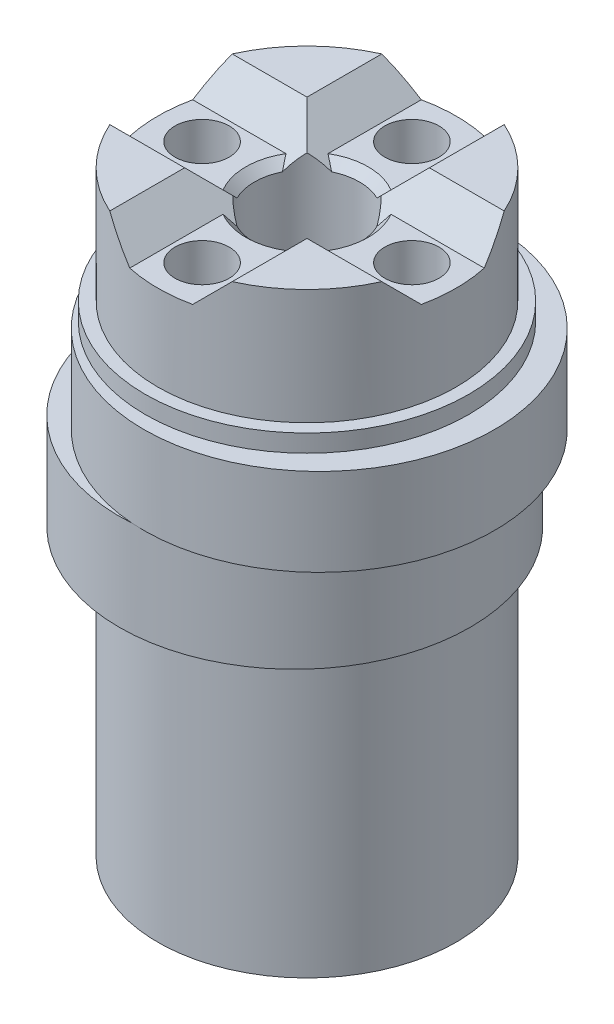
from build123d import *

# Parameters (mm, degrees)
SKETCH1_R            = 10.03
BOSS_EXTRUDE11_DEPTH = 5.5
SKETCH20_R           = 10.03
BOSS_EXTRUDE12_DEPTH = 5
SKETCH21_R           = 9.25
BOSS_EXTRUDE13_DEPTH = 1
SKETCH22_R           = 8.53
BOSS_EXTRUDE14_DEPTH = 6.6
BOSS_EXTRUDE15_START = 16
SKETCH30_R           = 8.53
BOSS_EXTRUDE15_DEPTH = 16
SKETCH31_R           = 1.55
CUT_EXTRUDE12_DEPTH  = 34.1
SKETCH33_R           = 2.1
CUT_EXTRUDE14_DEPTH  = 5.8
SKETCH36_R           = 3
CUT_EXTRUDE18_DEPTH  = 28.3
SKETCH37_W           = 9.5
SKETCH37_H           = 7
CUT_EXTRUDE19_DEPTH  = 1.7
CIRPATTERN1_COUNT    = 4
CHAMFER1_SIZE        = 1.7
CHAMFER2_SIZE        = 0.5


with BuildPart() as part:
    # Sketch1 → Boss-Extrude11 (new body)
    with BuildSketch(Plane(origin=(0, 0, 0), x_dir=(1, 0, 0), z_dir=(0, 1, 0))):
        with Locations(Location((0, 0, 0), (0, 0, 270))):
            Circle(SKETCH1_R)
    extrude(amount=BOSS_EXTRUDE11_DEPTH)

    # Sketch20 → Boss-Extrude12 (add)
    with BuildSketch(Plane(origin=(0, 5.5, 0), x_dir=(1, 0, 0), z_dir=(0, 1, 0))):
        with Locations(Location((1.4, 0, 0), (0, 0, 94.001961682))):
            Circle(SKETCH20_R)
    extrude(amount=BOSS_EXTRUDE12_DEPTH)

    # Sketch21 → Boss-Extrude13 (add)
    with BuildSketch(Plane(origin=(0, 10.5, 0), x_dir=(1, 0, 0), z_dir=(0, 1, 0))):
        with Locations(Location((0.7, 0, 0), (0, 0, 270))):
            Circle(SKETCH21_R)
    extrude(amount=BOSS_EXTRUDE13_DEPTH)

    # Sketch22 → Boss-Extrude14 (add)
    with BuildSketch(Plane(origin=(0, 11.5, 0), x_dir=(1, 0, 0), z_dir=(0, 1, 0))):
        with Locations(Location((0.7, 0, 0), (0, 0, 270))):
            Circle(SKETCH22_R)
    extrude(amount=BOSS_EXTRUDE14_DEPTH)

    # Sketch30 → Boss-Extrude15 (add)
    with BuildSketch(Plane.XZ.offset(BOSS_EXTRUDE15_START)):
        with Locations(Location((0.7, 0, 0), (0, 0, 90))):
            Circle(SKETCH30_R)
    extrude(amount=-BOSS_EXTRUDE15_DEPTH)

    # Sketch31 → Cut-Extrude12 (cut)
    with BuildSketch(Plane(origin=(0, 18.1, 0), x_dir=(1, 0, 0), z_dir=(0, 1, 0))):
        with Locations(Location((6.7, 0, 0), (0, 0, 270))):
            Circle(SKETCH31_R)
    cut_extrude12 = extrude(amount=-CUT_EXTRUDE12_DEPTH, mode=Mode.SUBTRACT)

    # Sketch33 → Cut-Extrude14 (cut)
    with BuildSketch(Plane.XZ.offset(16)):
        with Locations(Location((0.7, 0, 0), (0, 0, 270))):
            Circle(SKETCH33_R)
    extrude(amount=-CUT_EXTRUDE14_DEPTH, mode=Mode.SUBTRACT)

    # Sketch36 → Cut-Extrude18 (cut)
    with BuildSketch(Plane(origin=(0, 18.1, 0), x_dir=(1, 0, 0), z_dir=(0, 1, 0))):
        with Locations(Location((0.7, 0, 0), (0, 0, 270))):
            Circle(SKETCH36_R)
    extrude(amount=-CUT_EXTRUDE18_DEPTH, mode=Mode.SUBTRACT)

    # Sketch37 → Cut-Extrude19 (cut)
    with BuildSketch(Plane(origin=(0, 18.1, 0), x_dir=(1, 0, 0), z_dir=(0, 1, 0))):
        with Locations((5.45, 0)):
            Rectangle(SKETCH37_W, SKETCH37_H)
    cut_extrude19 = extrude(amount=-CUT_EXTRUDE19_DEPTH, mode=Mode.SUBTRACT)

    # CirPattern1: Cut-Extrude12, Cut-Extrude19 ×4 about axis
    cirpattern1_axis = Axis((0.7, 0, 0), (0, 1, 0))
    add([cut_extrude12.rotate(cirpattern1_axis, i * 360 / CIRPATTERN1_COUNT) for i in range(1, CIRPATTERN1_COUNT)], mode=Mode.SUBTRACT)
    add([cut_extrude19.rotate(cirpattern1_axis, i * 360 / CIRPATTERN1_COUNT) for i in range(1, CIRPATTERN1_COUNT)], mode=Mode.SUBTRACT)

    # Chamfer1
    # the kernel refuses this chamfer: 1.7 mm, written as the material it adds along each edge
    with BuildSketch(Plane(origin=(12.85073632, 16.4, -3.5), x_dir=(0, 0.9996219169112968, -0.027495876610586365), z_dir=(-1, 0, 0))) as chamfer1_piece_1_section:
        Polygon((CHAMFER1_SIZE * 0.999621916911, -CHAMFER1_SIZE * 0.0274958766106), (-CHAMFER1_SIZE * 0.0274958766106, -CHAMFER1_SIZE * 0.999621916911), (0, 0), align=None)
    chamfer1_piece_1 = extrude(amount=8.65073632, mode=Mode.PRIVATE)
    chamfer1_piece_1 = chamfer1_piece_1 & Plane(origin=(0.7, 16.951076754, 0), x_dir=(0, 0, 1), z_dir=(0, -1, 0)) * Cylinder(8.53, 25, mode=Mode.PRIVATE)
    chamfer1_piece_1 = split(chamfer1_piece_1, bisect_by=Plane(origin=(6.450066767, 18.1, -2.924017163), z_dir=(0, -1, 0)), keep=Keep.TOP, mode=Mode.PRIVATE)
    add(chamfer1_piece_1)
    with BuildSketch(Plane(origin=(4.2, 16.4, 3.5), x_dir=(0, 0.9996219169112968, 0.027495876610581792), z_dir=(1, 0, 0))) as chamfer1_piece_2_section:
        Polygon((CHAMFER1_SIZE * 0.999621916911, -CHAMFER1_SIZE * 0.0274958766106), (-CHAMFER1_SIZE * 0.0274958766106, -CHAMFER1_SIZE * 0.999621916911), (0, 0), align=None)
    chamfer1_piece_2 = extrude(amount=8.65073632, mode=Mode.PRIVATE)
    chamfer1_piece_2 = chamfer1_piece_2 & Plane(origin=(0.7, 16.951076754, 0), x_dir=(0, 0, 1), z_dir=(0, -1, 0)) * Cylinder(8.53, 25, mode=Mode.PRIVATE)
    chamfer1_piece_2 = split(chamfer1_piece_2, bisect_by=Plane(origin=(6.450066768, 18.1, 2.924017163), z_dir=(0, -1, 0)), keep=Keep.TOP, mode=Mode.PRIVATE)
    add(chamfer1_piece_2)
    with BuildSketch(Plane(origin=(-2.8, 16.4, -12.15073632), x_dir=(-0.027495876610586365, 0.9996219169112968, 0), z_dir=(0, 0, 1))) as chamfer1_piece_3_section:
        Polygon((CHAMFER1_SIZE * 0.999621916911, -CHAMFER1_SIZE * 0.0274958766106), (-CHAMFER1_SIZE * 0.0274958766106, -CHAMFER1_SIZE * 0.999621916911), (0, 0), align=None)
    chamfer1_piece_3 = extrude(amount=8.65073632, mode=Mode.PRIVATE)
    chamfer1_piece_3 = chamfer1_piece_3 & Plane(origin=(0.7, 16.951076754, 0), x_dir=(0, 0, 1), z_dir=(0, -1, 0)) * Cylinder(8.53, 25, mode=Mode.PRIVATE)
    chamfer1_piece_3 = split(chamfer1_piece_3, bisect_by=Plane(origin=(-2.224017163, 18.1, -5.750066767), z_dir=(0, -1, 0)), keep=Keep.TOP, mode=Mode.PRIVATE)
    add(chamfer1_piece_3)
    with BuildSketch(Plane(origin=(-2.8, 16.4, -3.5), x_dir=(0, 0.9996219169112968, -0.027495876610586365), z_dir=(-1, 0, 0))) as chamfer1_piece_4_section:
        Polygon((CHAMFER1_SIZE * 0.999621916911, -CHAMFER1_SIZE * 0.0274958766106), (-CHAMFER1_SIZE * 0.0274958766106, -CHAMFER1_SIZE * 0.999621916911), (0, 0), align=None)
    chamfer1_piece_4 = extrude(amount=8.65073632, mode=Mode.PRIVATE)
    chamfer1_piece_4 = chamfer1_piece_4 & Plane(origin=(0.7, 16.951076754, 0), x_dir=(0, 0, 1), z_dir=(0, -1, 0)) * Cylinder(8.53, 25, mode=Mode.PRIVATE)
    chamfer1_piece_4 = split(chamfer1_piece_4, bisect_by=Plane(origin=(-5.050066768, 18.1, -2.924017163), z_dir=(0, -1, 0)), keep=Keep.TOP, mode=Mode.PRIVATE)
    add(chamfer1_piece_4)
    with BuildSketch(Plane(origin=(-11.45073632, 16.4, 3.5), x_dir=(0, 0.9996219169112968, 0.027495876610586365), z_dir=(1, 0, 0))) as chamfer1_piece_5_section:
        Polygon((CHAMFER1_SIZE * 0.999621916911, -CHAMFER1_SIZE * 0.0274958766106), (-CHAMFER1_SIZE * 0.0274958766106, -CHAMFER1_SIZE * 0.999621916911), (0, 0), align=None)
    chamfer1_piece_5 = extrude(amount=8.65073632, mode=Mode.PRIVATE)
    chamfer1_piece_5 = chamfer1_piece_5 & Plane(origin=(0.7, 16.951076754, 0), x_dir=(0, 0, 1), z_dir=(0, -1, 0)) * Cylinder(8.53, 25, mode=Mode.PRIVATE)
    chamfer1_piece_5 = split(chamfer1_piece_5, bisect_by=Plane(origin=(-5.050066767, 18.1, 2.924017163), z_dir=(0, -1, 0)), keep=Keep.TOP, mode=Mode.PRIVATE)
    add(chamfer1_piece_5)
    with BuildSketch(Plane(origin=(-2.8, 16.4, 3.5), x_dir=(-0.027495876610586365, 0.9996219169112968, 0), z_dir=(0, 0, 1))) as chamfer1_piece_6_section:
        Polygon((CHAMFER1_SIZE * 0.999621916911, -CHAMFER1_SIZE * 0.0274958766106), (-CHAMFER1_SIZE * 0.0274958766106, -CHAMFER1_SIZE * 0.999621916911), (0, 0), align=None)
    chamfer1_piece_6 = extrude(amount=8.65073632, mode=Mode.PRIVATE)
    chamfer1_piece_6 = chamfer1_piece_6 & Plane(origin=(0.7, 16.951076754, 0), x_dir=(0, 0, 1), z_dir=(0, -1, 0)) * Cylinder(8.53, 25, mode=Mode.PRIVATE)
    chamfer1_piece_6 = split(chamfer1_piece_6, bisect_by=Plane(origin=(-2.224017163, 18.1, 5.750066768), z_dir=(0, -1, 0)), keep=Keep.TOP, mode=Mode.PRIVATE)
    add(chamfer1_piece_6)
    with BuildSketch(Plane(origin=(4.2, 16.4, 12.15073632), x_dir=(0.027495876610586365, 0.9996219169112968, 0), z_dir=(0, 0, -1))) as chamfer1_piece_7_section:
        Polygon((CHAMFER1_SIZE * 0.999621916911, -CHAMFER1_SIZE * 0.0274958766106), (-CHAMFER1_SIZE * 0.0274958766106, -CHAMFER1_SIZE * 0.999621916911), (0, 0), align=None)
    chamfer1_piece_7 = extrude(amount=8.65073632, mode=Mode.PRIVATE)
    chamfer1_piece_7 = chamfer1_piece_7 & Plane(origin=(0.7, 16.951076754, 0), x_dir=(0, 0, 1), z_dir=(0, -1, 0)) * Cylinder(8.53, 25, mode=Mode.PRIVATE)
    chamfer1_piece_7 = split(chamfer1_piece_7, bisect_by=Plane(origin=(3.624017163, 18.1, 5.750066767), z_dir=(0, -1, 0)), keep=Keep.TOP, mode=Mode.PRIVATE)
    add(chamfer1_piece_7)
    with BuildSketch(Plane(origin=(4.2, 16.4, -3.5), x_dir=(0.027495876610586365, 0.9996219169112968, 0), z_dir=(0, 0, -1))) as chamfer1_piece_8_section:
        Polygon((CHAMFER1_SIZE * 0.999621916911, -CHAMFER1_SIZE * 0.0274958766106), (-CHAMFER1_SIZE * 0.0274958766106, -CHAMFER1_SIZE * 0.999621916911), (0, 0), align=None)
    chamfer1_piece_8 = extrude(amount=8.65073632, mode=Mode.PRIVATE)
    chamfer1_piece_8 = chamfer1_piece_8 & Plane(origin=(0.7, 16.951076754, 0), x_dir=(0, 0, 1), z_dir=(0, -1, 0)) * Cylinder(8.53, 25, mode=Mode.PRIVATE)
    chamfer1_piece_8 = split(chamfer1_piece_8, bisect_by=Plane(origin=(3.624017163, 18.1, -5.750066768), z_dir=(0, -1, 0)), keep=Keep.TOP, mode=Mode.PRIVATE)
    add(chamfer1_piece_8)
    with BuildSketch(Plane(origin=(12.85073632, 16.4, -3.5), x_dir=(0, 0.9996219169112968, -0.027495876610586365), z_dir=(-1, 0, 0))) as chamfer1_piece_9a_section:
        Polygon((CHAMFER1_SIZE * 0.999621916911, -CHAMFER1_SIZE * 0.0274958766106), (-CHAMFER1_SIZE * 0.0274958766106, -CHAMFER1_SIZE * 0.999621916911), (0, 0), align=None)
    chamfer1_piece_9a = extrude(amount=13.022597399, mode=Mode.PRIVATE)
    chamfer1_piece_9a = split(chamfer1_piece_9a, bisect_by=Plane(origin=(2.33024723, 18.1, -3.085534958), z_dir=(0, -1, 0)), keep=Keep.TOP, mode=Mode.PRIVATE)
    chamfer1_piece_9a = split(chamfer1_piece_9a, bisect_by=Plane(origin=(4.2, 17.035605809, -3.085534958), z_dir=(-1, 0, 0)), keep=Keep.TOP, mode=Mode.PRIVATE)
    chamfer1_piece_9a = chamfer1_piece_9a - Plane(origin=(0.7, 17.035605809, 0), x_dir=(0, 0, 1), z_dir=(0, 1, 0)) * Cylinder(3, 33, mode=Mode.PRIVATE)
    with BuildSketch(Plane(origin=(4.2, 16.4, 0.87186108), x_dir=(0.027495876610586365, 0.9996219169112968, 0), z_dir=(0, 0, -1))) as chamfer1_piece_9b_section:
        Polygon((CHAMFER1_SIZE * 0.999621916911, -CHAMFER1_SIZE * 0.0274958766106), (-CHAMFER1_SIZE * 0.0274958766106, -CHAMFER1_SIZE * 0.999621916911), (0, 0), align=None)
    chamfer1_piece_9b = extrude(amount=13.022597399, mode=Mode.PRIVATE)
    chamfer1_piece_9b = split(chamfer1_piece_9b, bisect_by=Plane(origin=(3.785535078, 17.035605902, -3.5), z_dir=(0, 0, 1)), keep=Keep.TOP, mode=Mode.PRIVATE)
    chamfer1_piece_9b = split(chamfer1_piece_9b, bisect_by=Plane(origin=(3.785535078, 18.1, -1.630247283), z_dir=(0, -1, 0)), keep=Keep.TOP, mode=Mode.PRIVATE)
    chamfer1_piece_9b = chamfer1_piece_9b - Plane(origin=(0.7, 17.035605902, 0), x_dir=(0, 0, 1), z_dir=(0, 1, 0)) * Cylinder(3, 33, mode=Mode.PRIVATE)
    chamfer1_piece_9 = chamfer1_piece_9a & chamfer1_piece_9b
    add(chamfer1_piece_9)
    with BuildSketch(Plane(origin=(4.2, 16.4, 12.15073632), x_dir=(0.027495876610586365, 0.9996219169112968, 0), z_dir=(0, 0, -1))) as chamfer1_piece_10a_section:
        Polygon((CHAMFER1_SIZE * 0.999621916911, -CHAMFER1_SIZE * 0.0274958766106), (-CHAMFER1_SIZE * 0.0274958766106, -CHAMFER1_SIZE * 0.999621916911), (0, 0), align=None)
    chamfer1_piece_10a = extrude(amount=13.022597399, mode=Mode.PRIVATE)
    chamfer1_piece_10a = split(chamfer1_piece_10a, bisect_by=Plane(origin=(3.785534958, 18.1, 1.63024723), z_dir=(0, -1, 0)), keep=Keep.TOP, mode=Mode.PRIVATE)
    chamfer1_piece_10a = split(chamfer1_piece_10a, bisect_by=Plane(origin=(3.785534958, 17.035605809, 3.5), z_dir=(0, 0, -1)), keep=Keep.TOP, mode=Mode.PRIVATE)
    chamfer1_piece_10a = chamfer1_piece_10a - Plane(origin=(0.7, 17.035605809, 0), x_dir=(0, 0, 1), z_dir=(0, 1, 0)) * Cylinder(3, 33, mode=Mode.PRIVATE)
    with BuildSketch(Plane(origin=(-0.17186108, 16.4, 3.5), x_dir=(0, 0.9996219169112968, 0.027495876610586365), z_dir=(1, 0, 0))) as chamfer1_piece_10b_section:
        Polygon((CHAMFER1_SIZE * 0.999621916911, -CHAMFER1_SIZE * 0.0274958766106), (-CHAMFER1_SIZE * 0.0274958766106, -CHAMFER1_SIZE * 0.999621916911), (0, 0), align=None)
    chamfer1_piece_10b = extrude(amount=13.022597399, mode=Mode.PRIVATE)
    chamfer1_piece_10b = split(chamfer1_piece_10b, bisect_by=Plane(origin=(4.2, 17.035605903, 3.08553508), z_dir=(-1, 0, 0)), keep=Keep.TOP, mode=Mode.PRIVATE)
    chamfer1_piece_10b = split(chamfer1_piece_10b, bisect_by=Plane(origin=(2.330247274, 18.1, 3.08553508), z_dir=(0, -1, 0)), keep=Keep.TOP, mode=Mode.PRIVATE)
    chamfer1_piece_10b = chamfer1_piece_10b - Plane(origin=(0.7, 17.035605903, 0), x_dir=(0, 0, 1), z_dir=(0, 1, 0)) * Cylinder(3, 33, mode=Mode.PRIVATE)
    chamfer1_piece_10 = chamfer1_piece_10a & chamfer1_piece_10b
    add(chamfer1_piece_10)
    with BuildSketch(Plane(origin=(-2.8, 16.4, -12.15073632), x_dir=(-0.027495876610586365, 0.9996219169112968, 0), z_dir=(0, 0, 1))) as chamfer1_piece_11a_section:
        Polygon((CHAMFER1_SIZE * 0.999621916911, -CHAMFER1_SIZE * 0.0274958766106), (-CHAMFER1_SIZE * 0.0274958766106, -CHAMFER1_SIZE * 0.999621916911), (0, 0), align=None)
    chamfer1_piece_11a = extrude(amount=13.022597399, mode=Mode.PRIVATE)
    chamfer1_piece_11a = split(chamfer1_piece_11a, bisect_by=Plane(origin=(-2.385534958, 18.1, -1.63024723), z_dir=(0, -1, 0)), keep=Keep.TOP, mode=Mode.PRIVATE)
    chamfer1_piece_11a = split(chamfer1_piece_11a, bisect_by=Plane(origin=(-2.385534958, 17.035605809, -3.5), z_dir=(0, 0, 1)), keep=Keep.TOP, mode=Mode.PRIVATE)
    chamfer1_piece_11a = chamfer1_piece_11a - Plane(origin=(0.7, 17.035605809, 0), x_dir=(0, 0, 1), z_dir=(0, 1, 0)) * Cylinder(3, 33, mode=Mode.PRIVATE)
    with BuildSketch(Plane(origin=(1.57186108, 16.4, -3.5), x_dir=(0, 0.9996219169112968, -0.027495876610586365), z_dir=(-1, 0, 0))) as chamfer1_piece_11b_section:
        Polygon((CHAMFER1_SIZE * 0.999621916911, -CHAMFER1_SIZE * 0.0274958766106), (-CHAMFER1_SIZE * 0.0274958766106, -CHAMFER1_SIZE * 0.999621916911), (0, 0), align=None)
    chamfer1_piece_11b = extrude(amount=13.022597399, mode=Mode.PRIVATE)
    chamfer1_piece_11b = split(chamfer1_piece_11b, bisect_by=Plane(origin=(-2.8, 17.035605902, -3.085535078), z_dir=(1, 0, 0)), keep=Keep.TOP, mode=Mode.PRIVATE)
    chamfer1_piece_11b = split(chamfer1_piece_11b, bisect_by=Plane(origin=(-0.930247283, 18.1, -3.085535078), z_dir=(0, -1, 0)), keep=Keep.TOP, mode=Mode.PRIVATE)
    chamfer1_piece_11b = chamfer1_piece_11b - Plane(origin=(0.7, 17.035605902, 0), x_dir=(0, 0, 1), z_dir=(0, 1, 0)) * Cylinder(3, 33, mode=Mode.PRIVATE)
    chamfer1_piece_11 = chamfer1_piece_11a & chamfer1_piece_11b
    add(chamfer1_piece_11)
    with BuildSketch(Plane(origin=(-11.45073632, 16.4, 3.5), x_dir=(0, 0.9996219169112968, 0.027495876610586365), z_dir=(1, 0, 0))) as chamfer1_piece_12a_section:
        Polygon((CHAMFER1_SIZE * 0.999621916911, -CHAMFER1_SIZE * 0.0274958766106), (-CHAMFER1_SIZE * 0.0274958766106, -CHAMFER1_SIZE * 0.999621916911), (0, 0), align=None)
    chamfer1_piece_12a = extrude(amount=13.022597399, mode=Mode.PRIVATE)
    chamfer1_piece_12a = split(chamfer1_piece_12a, bisect_by=Plane(origin=(-0.930247276, 18.1, 3.08553506), z_dir=(0, -1, 0)), keep=Keep.TOP, mode=Mode.PRIVATE)
    chamfer1_piece_12a = split(chamfer1_piece_12a, bisect_by=Plane(origin=(-2.8, 17.035605889, 3.08553506), z_dir=(1, 0, 0)), keep=Keep.TOP, mode=Mode.PRIVATE)
    chamfer1_piece_12a = chamfer1_piece_12a - Plane(origin=(0.7, 17.035605889, 0), x_dir=(0, 0, 1), z_dir=(0, 1, 0)) * Cylinder(3, 33, mode=Mode.PRIVATE)
    with BuildSketch(Plane(origin=(-2.8, 16.4, -0.87186108), x_dir=(-0.027495876610586365, 0.9996219169112968, 0), z_dir=(0, 0, 1))) as chamfer1_piece_12b_section:
        Polygon((CHAMFER1_SIZE * 0.999621916911, -CHAMFER1_SIZE * 0.0274958766106), (-CHAMFER1_SIZE * 0.0274958766106, -CHAMFER1_SIZE * 0.999621916911), (0, 0), align=None)
    chamfer1_piece_12b = extrude(amount=13.022597399, mode=Mode.PRIVATE)
    chamfer1_piece_12b = split(chamfer1_piece_12b, bisect_by=Plane(origin=(-2.385535078, 17.035605902, 3.5), z_dir=(0, 0, -1)), keep=Keep.TOP, mode=Mode.PRIVATE)
    chamfer1_piece_12b = split(chamfer1_piece_12b, bisect_by=Plane(origin=(-2.385535078, 18.1, 1.630247283), z_dir=(0, -1, 0)), keep=Keep.TOP, mode=Mode.PRIVATE)
    chamfer1_piece_12b = chamfer1_piece_12b - Plane(origin=(0.7, 17.035605902, 0), x_dir=(0, 0, 1), z_dir=(0, 1, 0)) * Cylinder(3, 33, mode=Mode.PRIVATE)
    chamfer1_piece_12 = chamfer1_piece_12a & chamfer1_piece_12b
    add(chamfer1_piece_12)

    # Chamfer2
    chamfer2_edges = [part.edges().sort_by_distance(p)[0] for p in [
        (-2.3, 16.4, 0),
        (1.648683298, 16.4, 2.846049894),
        (3.7, 16.4, 0),
        (0.7, 16.4, -3),
    ]]
    chamfer(chamfer2_edges, length=CHAMFER2_SIZE)


solid = part.part
